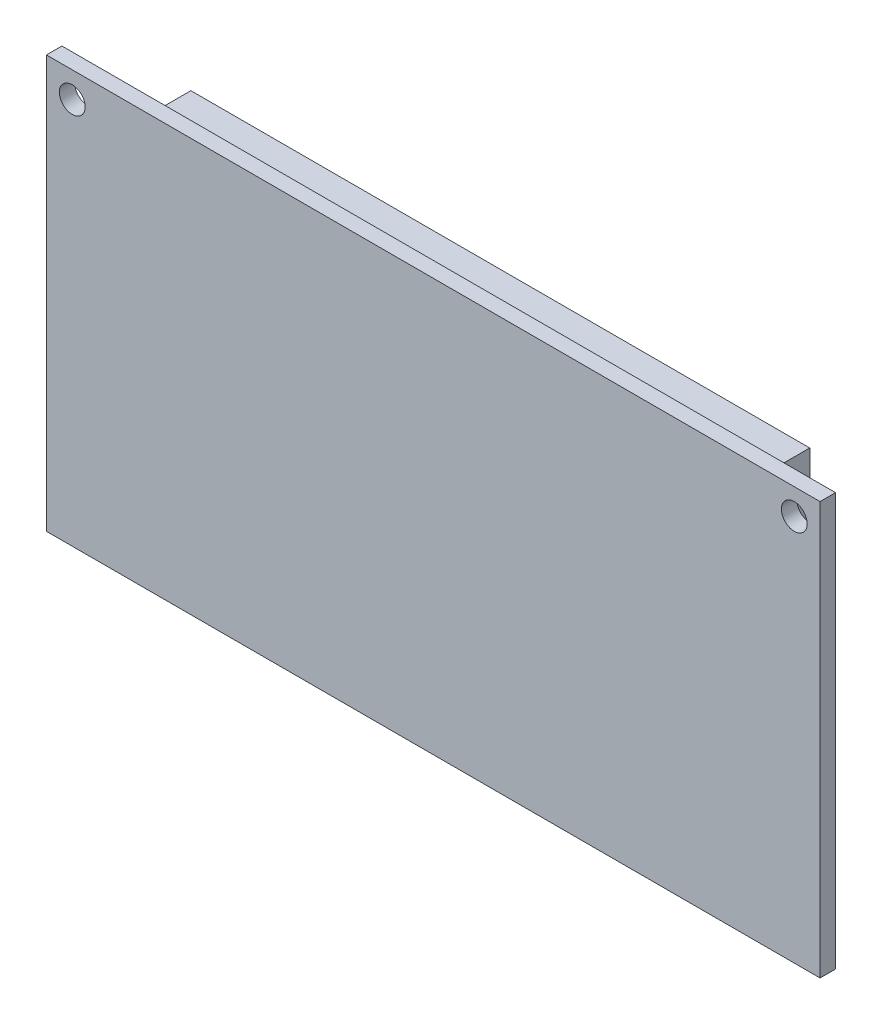
from build123d import *

# Parameters (mm, degrees)
SKETCH1_W               = 150
SKETCH1_H               = 80
BOSS_EXTRUDE2_DEPTH     = 3
BOSS_EXTRUDE4_OUTLINE_W = 120
BOSS_EXTRUDE4_OUTLINE_H = 70
BOSS_EXTRUDE4_DEPTH     = 15
BOSS_EXTRUDE5_DEPTH     = 5
SKETCH6_W               = 110
SKETCH6_H               = 60
CUT_EXTRUDE1_DEPTH      = 5
SKETCH7_R               = 2.5
CUT_EXTRUDE2_DEPTH      = 5


# Read off the part's stored shape, not the designer's step: Boss-Extrude4
with BuildPart() as part:
    # Sketch1 → Boss-Extrude2 (new body)
    with BuildSketch(Plane.XY):
        with Locations((61.381224804, 30.24216319)):
            Rectangle(SKETCH1_W, SKETCH1_H)
    extrude(amount=BOSS_EXTRUDE2_DEPTH)

    # Boss-Extrude4 outline → Boss-Extrude4 (add)
    with BuildSketch(Plane(origin=(0, 0, 0), x_dir=(-1, 0, 0), z_dir=(0, 0, -1))):
        with Locations((-56.381224804, 25.24216319)):
            Rectangle(BOSS_EXTRUDE4_OUTLINE_W, BOSS_EXTRUDE4_OUTLINE_H)
    extrude(amount=BOSS_EXTRUDE4_DEPTH)

    # Sketch5 → Boss-Extrude5 (add)
    with BuildSketch(Plane(origin=(0, 0, 0), x_dir=(-1, 0, 0), z_dir=(0, 0, -1))):
        Polygon((-124.381224804, 19.24216319), (-124.381224804, 40.49216319), (-116.381224804, 40.49216319), (-116.381224804, -2.00783681), (-124.381224804, -2.00783681), align=None)
    extrude(amount=BOSS_EXTRUDE5_DEPTH)

    # Sketch6 → Cut-Extrude1 (cut)
    with BuildSketch(Plane(origin=(0, 0, -15), x_dir=(-1, 0, 0), z_dir=(0, 0, -1))):
        with Locations((-56.381224804, 25.24216319)):
            Rectangle(SKETCH6_W, SKETCH6_H)
    extrude(amount=-CUT_EXTRUDE1_DEPTH, mode=Mode.SUBTRACT)

    # Sketch7 → Cut-Extrude2 (cut)
    with BuildSketch(Plane(origin=(0, 0, 0), x_dir=(-1, 0, 0), z_dir=(0, 0, -1))):
        with Locations((-131.381224804, 65.24216319)):
            Circle(SKETCH7_R)
        with Locations((8.618775196, 65.24216319)):
            Circle(SKETCH7_R)
        with Locations((-131.381224804, -29.765126005)):
            Circle(SKETCH7_R)
        with Locations((8.618775196, -29.765126005)):
            Circle(SKETCH7_R)
    extrude(amount=-CUT_EXTRUDE2_DEPTH, mode=Mode.SUBTRACT)


solid = part.part
